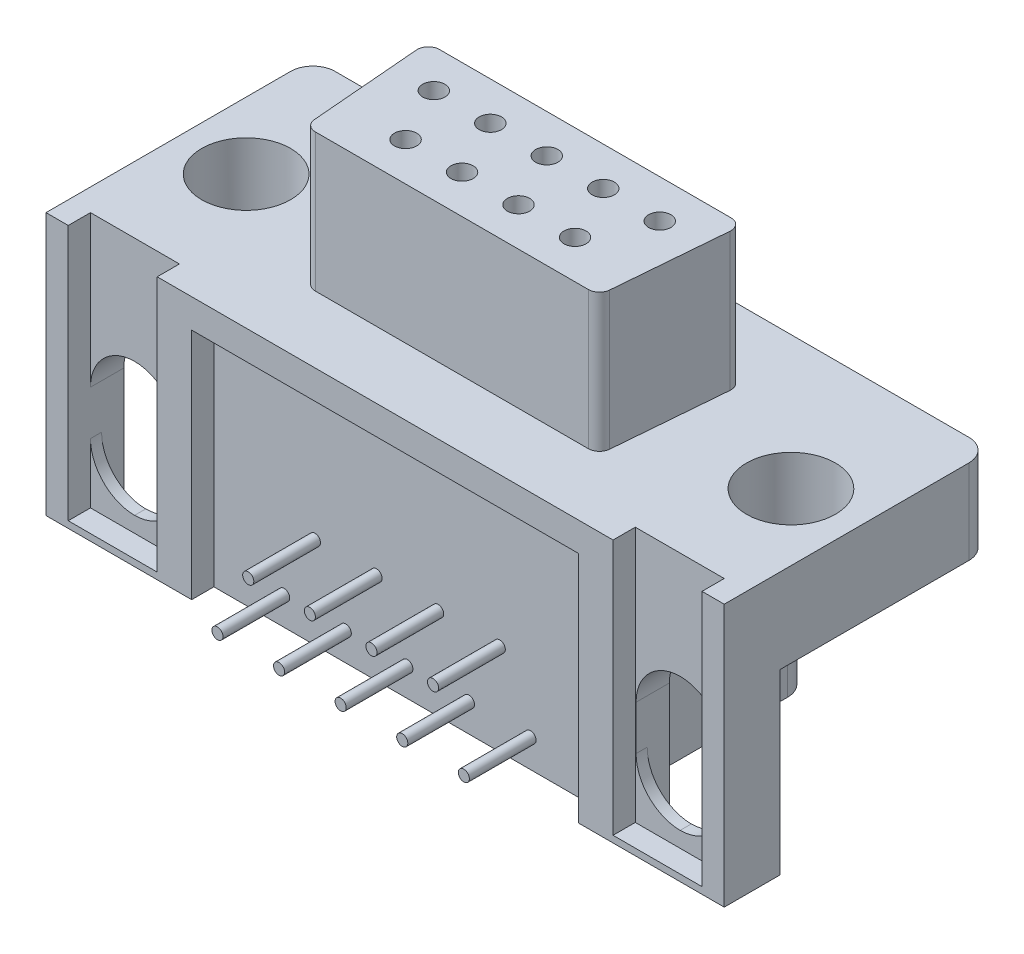
from build123d import *

# Parameters (mm, degrees)
SKETCH_1_W          = 30.5
SKETCH_1_H          = 12
EXTRUDE_1_DEPTH     = 18
SKETCH_2_W          = 30.5
SKETCH_2_H          = 12
CUT_EXTRUDE_2_DEPTH = 6.2
SKETCH_3_R          = 2
SKETCH_3_W          = 4
SKETCH_3_H          = 1
CUT_EXTRUDE_3_DEPTH = 11.5
CUT_EXTRUDE_4_DEPTH = 8
SKETCH_5_W          = 3.964363922
SKETCH_5_H          = 1
CUT_EXTRUDE_6_DEPTH = 7
SKETCH_6_W          = 3.964363922
SKETCH_6_H          = 6
CUT_EXTRUDE_7_DEPTH = 26.822712871
FILLET_1_R          = 2
FILLET_2_R          = 2
FILLET_3_R          = 1
SKETCH_7_W          = 17.4
SKETCH_7_H          = 5.750693342
CUT_EXTRUDE_8_DEPTH = 10.5
SKETCH_9_R          = 0.5
CUT_EXTRUDE_9_DEPTH = 8
SKETCH_8_R          = 0.25
EXTRUDE_2_DEPTH     = 3


with BuildPart() as part:
    # 草图1 → 凸台-拉伸1 (new body)
    with BuildSketch(Plane(origin=(0, 0, 0), x_dir=(1, 0, 0), z_dir=(0, 1, 0))):
        Rectangle(SKETCH_1_W, SKETCH_1_H)
    extrude(amount=EXTRUDE_1_DEPTH)

    # 草图2 → 切除-拉伸2 (cut)
    with BuildSketch(Plane(origin=(0, 18, 0), x_dir=(1, 0, 0), z_dir=(0, 1, 0))):
        Rectangle(SKETCH_2_W, SKETCH_2_H)
        with BuildLine():
            Line((-6.556600226, 3), (6.556600226, 3))
            ThreePointArc((6.556600226, 3), (6.924541369, 2.838554744), (7.054873105, 2.45847726))
            Line((7.054873105, 2.45847726), (6.638206438, -2.54152274))
            ThreePointArc((6.638206438, -2.54152274), (6.478488304, -2.867941143), (6.139933559, -3))
            Line((6.139933559, -3), (-6.139933559, -3))
            ThreePointArc((-6.139933559, -3), (-6.478488304, -2.867941143), (-6.638206438, -2.54152274))
            Line((-6.638206438, -2.54152274), (-7.054873105, 2.45847726))
            ThreePointArc((-7.054873105, 2.45847726), (-6.924541369, 2.838554744), (-6.556600226, 3))
        make_face(mode=Mode.SUBTRACT)
    extrude(amount=-CUT_EXTRUDE_2_DEPTH, mode=Mode.SUBTRACT)

    # 草图3 → 切除-拉伸3 (cut)
    with BuildSketch(Plane(origin=(0, 11.8, 0), x_dir=(1, 0, 0), z_dir=(0, 1, 0))):
        with Locations(Location((12.25, 0, 0), (0, 0, 270))):
            Circle(SKETCH_3_R)
        with Locations(Location((-12.25, 0, 0), (0, 0, 90))):
            Circle(SKETCH_3_R)
        with Locations((12.25, -5.5)):
            Rectangle(SKETCH_3_W, SKETCH_3_H)
        with Locations((-12.25, -5.5)):
            Rectangle(SKETCH_3_W, SKETCH_3_H)
    extrude(amount=-CUT_EXTRUDE_3_DEPTH, mode=Mode.SUBTRACT)

    # 草图4 → 切除-拉伸4 (cut)
    with BuildSketch(Plane.XZ):
        Polygon((8.5, -4.6), (8.5, 3.5), (15.25, 3.5), (15.25, -4.6), (15.25, -6), (-15.25, -6), (-15.25, 3.5), (-8.5, 3.5), (-8.5, -4.6), align=None)
    extrude(amount=-CUT_EXTRUDE_4_DEPTH, mode=Mode.SUBTRACT)

    # 草图5 → 切除-拉伸6 (cut)
    with BuildSketch(Plane.XZ):
        with Locations((12.267818039, 4)):
            Rectangle(SKETCH_5_W, SKETCH_5_H)
        with Locations((-12.267818039, 4)):
            Rectangle(SKETCH_5_W, SKETCH_5_H)
    extrude(amount=-CUT_EXTRUDE_6_DEPTH, mode=Mode.SUBTRACT)

    # 草图6 → 切除-拉伸7 (cut, through all)
    with BuildSketch(Plane(origin=(0, 0, 4.5), x_dir=(-1, 0, 0), z_dir=(0, 0, -1))):
        with Locations((12.267818039, 4)):
            Rectangle(SKETCH_6_W, SKETCH_6_H)
    cut_extrude_7 = extrude(amount=-CUT_EXTRUDE_7_DEPTH, mode=Mode.SUBTRACT)

    # 圆角1
    # the kernel refuses this fillet: 2 mm, written as the material it adds along each edge
    with BuildSketch(Plane(origin=(-14.25, 1, 4.5), x_dir=(0, 1, 0), z_dir=(0, 0, 1)), Plane(origin=(-10.285636078, 1, 4.5), x_dir=(-1, 0, 0), z_dir=(0, 0, 1))) as fillet_1_piece_1:
        with BuildLine():
            CenterArc((FILLET_1_R, -FILLET_1_R), FILLET_1_R, 90, 90)
            Line((0, -FILLET_1_R), (0, 0))
            Line((0, 0), (FILLET_1_R, 0))
        make_face()
    extrude(amount=0.5)
    with BuildSketch(Plane(origin=(-14.25, 7, 3.5), x_dir=(0, -1, 0), z_dir=(0, 0, 1))) as fillet_1_piece_2:
        with BuildLine():
            CenterArc((FILLET_1_R, FILLET_1_R), FILLET_1_R, 180, 90)
            Line((0, FILLET_1_R), (0, 0))
            Line((0, 0), (FILLET_1_R, 0))
        make_face()
    extrude(amount=1.5)
    with BuildSketch(Plane(origin=(-10.285636078, 7, 3.5), x_dir=(0, -1, 0), z_dir=(0, 0, 1))) as fillet_1_piece_3:
        with BuildLine():
            CenterArc((FILLET_1_R, -FILLET_1_R), FILLET_1_R, 90, 90)
            Line((0, -FILLET_1_R), (0, 0))
            Line((0, 0), (FILLET_1_R, 0))
        make_face()
    extrude(amount=1.5)

    # 镜向1: 切除-拉伸7 across plane
    add(cut_extrude_7.mirror(Plane(origin=(0, 0, 0), x_dir=(0, 0, 1), z_dir=(1, 0, 0))), mode=Mode.SUBTRACT)

    # 圆角2
    # the kernel refuses this fillet: 2 mm, written as the material it adds along each edge
    with BuildSketch(Plane(origin=(14.25, 1, 4.5), x_dir=(-1, 0, 0), z_dir=(0, 0, 1))) as fillet_2_piece_1:
        with BuildLine():
            CenterArc((FILLET_2_R, -FILLET_2_R), FILLET_2_R, 90, 90)
            Line((0, -FILLET_2_R), (0, 0))
            Line((0, 0), (FILLET_2_R, 0))
        make_face()
    extrude(amount=0.5)
    with BuildSketch(Plane(origin=(10.285636078, 1, 4.5), x_dir=(1, 0, 0), z_dir=(0, 0, 1))) as fillet_2_piece_2:
        with BuildLine():
            CenterArc((FILLET_2_R, FILLET_2_R), FILLET_2_R, 180, 90)
            Line((0, FILLET_2_R), (0, 0))
            Line((0, 0), (FILLET_2_R, 0))
        make_face()
    extrude(amount=0.5)
    with BuildSketch(Plane(origin=(10.285636078, 7, 3.5), x_dir=(1, 0, 0), z_dir=(0, 0, 1)), Plane(origin=(14.25, 7, 5), x_dir=(-1, 0, 0), z_dir=(0, 0, -1))) as fillet_2_piece_3:
        with BuildLine():
            CenterArc((FILLET_2_R, -FILLET_2_R), FILLET_2_R, 90, 90)
            Line((0, -FILLET_2_R), (0, 0))
            Line((0, 0), (FILLET_2_R, 0))
        make_face()
    extrude(amount=1.5)

    # 圆角3
    fillet_3_edges = [part.edges().sort_by_distance(p)[0] for p in [
        (-15.25, 9.9, -6),
        (15.25, 9.9, -6),
        (-8.5, 4, -4.6),
        (8.5, 4, -4.6),
    ]]
    fillet(fillet_3_edges, radius=FILLET_3_R)

    # 草图7 → 切除-拉伸8 (cut)
    with BuildSketch(Plane.XZ):
        with Locations((0, 7.875346671)):
            Rectangle(SKETCH_7_W, SKETCH_7_H)
    extrude(amount=-CUT_EXTRUDE_8_DEPTH, mode=Mode.SUBTRACT)

    # 草图9 → 切除-拉伸9 (cut)
    with BuildSketch(Plane(origin=(0, 18, 0), x_dir=(1, 0, 0), z_dir=(0, 1, 0))):
        with Locations(Location((0, 1.27, 0), (0, 0, 270))):
            Circle(SKETCH_9_R)
        with Locations(Location((2.54, 1.27, 0), (0, 0, 270))):
            Circle(SKETCH_9_R)
        with Locations(Location((5.08, 1.27, 0), (0, 0, 270))):
            Circle(SKETCH_9_R)
        with Locations(Location((-5.08, 1.27, 0), (0, 0, 90))):
            Circle(SKETCH_9_R)
        with Locations(Location((-2.54, 1.27, 0), (0, 0, 90))):
            Circle(SKETCH_9_R)
        with Locations(Location((-1.27, -1.27, 0), (0, 0, 270))):
            Circle(SKETCH_9_R)
        with Locations(Location((-3.81, -1.27, 0), (0, 0, 270))):
            Circle(SKETCH_9_R)
        with Locations(Location((3.81, -1.27, 0), (0, 0, 90))):
            Circle(SKETCH_9_R)
        with Locations(Location((1.27, -1.27, 0), (0, 0, 90))):
            Circle(SKETCH_9_R)
    extrude(amount=-CUT_EXTRUDE_9_DEPTH, mode=Mode.SUBTRACT)

    # 草图8 → 凸台-拉伸2 (add)
    with BuildSketch(Plane.XY.offset(5)):
        with Locations(Location((0, 1.27, 0), (0, 0, 180))):
            Circle(SKETCH_8_R)
        with Locations(Location((2.77, 1.27, 0), (0, 0, 180))):
            Circle(SKETCH_8_R)
        with Locations(Location((5.54, 1.27, 0), (0, 0, 180))):
            Circle(SKETCH_8_R)
        with Locations(Location((-5.54, 1.27, 0), (0, 0, 180))):
            Circle(SKETCH_8_R)
        with Locations(Location((-2.77, 1.27, 0), (0, 0, 180))):
            Circle(SKETCH_8_R)
        with Locations(Location((-1.385, 4.11, 0), (0, 0, 180))):
            Circle(SKETCH_8_R)
        with Locations(Location((1.385, 4.11, 0), (0, 0, 180))):
            Circle(SKETCH_8_R)
        with Locations(Location((-4.155, 4.11, 0), (0, 0, 180))):
            Circle(SKETCH_8_R)
        with Locations(Location((4.155, 4.11, 0), (0, 0, 180))):
            Circle(SKETCH_8_R)
    extrude(amount=EXTRUDE_2_DEPTH)


solid = part.part
